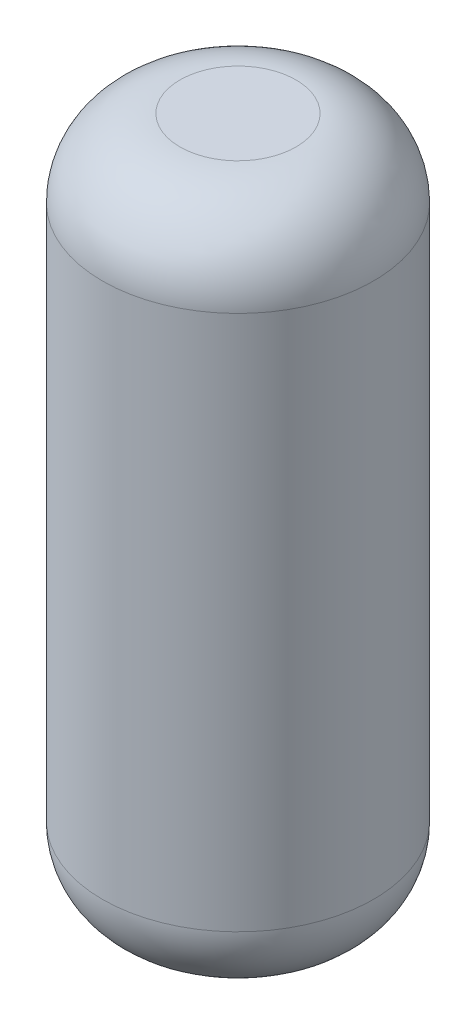
from build123d import *

# Parameters (mm, degrees)
SKETCH1_R           = 2.1
BOSS_EXTRUDE1_DEPTH = 10.7
FILLET1_R           = 1.2


with BuildPart() as part:
    # Sketch1 → Boss-Extrude1 (new body)
    with BuildSketch(Plane(origin=(0, 0, 0), x_dir=(1, 0, 0), z_dir=(0, 1, 0))):
        Circle(SKETCH1_R)
    extrude(amount=BOSS_EXTRUDE1_DEPTH)

    # Fillet1
    fillet1_edges = [part.edges().sort_by_distance(p)[0] for p in [
        (-2.1, 0, 0),
        (-2.1, 10.7, 0),
    ]]
    fillet(fillet1_edges, radius=FILLET1_R)


solid = part.part
